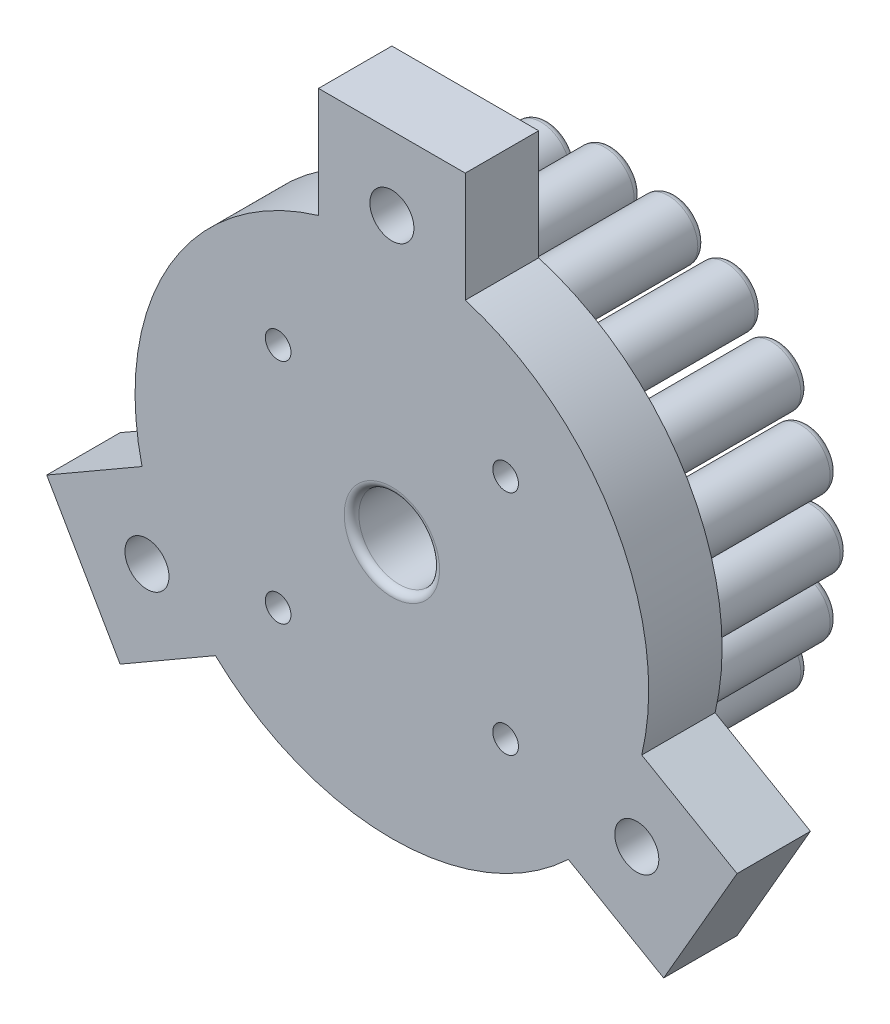
from build123d import *

# Parameters (mm, degrees)
SKIZZE1_R                          = 4
AUFSATZ_LINEAR_AUSTRAGEN1_DEPTH    = 20
AUFSATZ_LINEAR_AUSTRAGEN1_2_DEPTH  = 20
AUFSATZ_LINEAR_AUSTRAGEN1_3_DEPTH  = 20
AUFSATZ_LINEAR_AUSTRAGEN1_4_DEPTH  = 20
AUFSATZ_LINEAR_AUSTRAGEN1_5_DEPTH  = 20
AUFSATZ_LINEAR_AUSTRAGEN1_6_DEPTH  = 20
AUFSATZ_LINEAR_AUSTRAGEN1_7_DEPTH  = 20
AUFSATZ_LINEAR_AUSTRAGEN1_8_DEPTH  = 20
AUFSATZ_LINEAR_AUSTRAGEN1_9_DEPTH  = 20
AUFSATZ_LINEAR_AUSTRAGEN1_10_DEPTH = 20
AUFSATZ_LINEAR_AUSTRAGEN1_11_DEPTH = 20
AUFSATZ_LINEAR_AUSTRAGEN1_12_DEPTH = 20
AUFSATZ_LINEAR_AUSTRAGEN1_13_DEPTH = 20
AUFSATZ_LINEAR_AUSTRAGEN1_14_DEPTH = 20
AUFSATZ_LINEAR_AUSTRAGEN1_15_DEPTH = 20
AUFSATZ_LINEAR_AUSTRAGEN1_16_DEPTH = 20
AUFSATZ_LINEAR_AUSTRAGEN1_17_DEPTH = 20
AUFSATZ_LINEAR_AUSTRAGEN1_18_DEPTH = 20
AUFSATZ_LINEAR_AUSTRAGEN1_19_DEPTH = 20
AUFSATZ_LINEAR_AUSTRAGEN1_20_DEPTH = 20
SKIZZE5_R                          = 35
AUFSATZ_LINEAR_AUSTRAGEN2_DEPTH    = 10
SKIZZE6_R                          = 5.5
SCHNITT_LINEAR_AUSTRAGEN1_DEPTH    = 10
SKIZZE7_W                          = 20
SKIZZE7_H                          = 15
AUFSATZ_LINEAR_AUSTRAGEN3_DEPTH    = 10
SCHNITT_LINEAR_AUSTRAGEN3_REACH    = 75.951
SKIZZE9_R                          = 3
VERRUNDUNG1_R                      = 1
VERRUNDUNG2_R                      = 1
SKIZZE10_R                         = 1.75
SCHNITT_LINEAR_AUSTRAGEN4_DEPTH    = 10
SKIZZE12_R                         = 3.3
SCHNITT_LINEAR_AUSTRAGEN5_DEPTH    = 3


with BuildPart() as part:
    # Skizze1 → Aufsatz-Linear austragen1 (new body)
    with BuildSketch(Plane.XY):
        with Locations((0, 28.1)):
            Circle(SKIZZE1_R)
    extrude(amount=AUFSATZ_LINEAR_AUSTRAGEN1_DEPTH)



with BuildPart() as body_2:
    # Skizze1 → Aufsatz-Linear austragen1 2 (new body)
    with BuildSketch(Plane.XY):
        with Locations((8.683377542, 26.724688108)):
            Circle(SKIZZE1_R)
    extrude(amount=AUFSATZ_LINEAR_AUSTRAGEN1_2_DEPTH)


with BuildPart() as body_3:
    # Skizze1 → Aufsatz-Linear austragen1 3 (new body)
    with BuildSketch(Plane.XY):
        with Locations((16.516765589, 22.733377542)):
            Circle(SKIZZE1_R)
    extrude(amount=AUFSATZ_LINEAR_AUSTRAGEN1_3_DEPTH)


with BuildPart() as body_4:
    # Skizze1 → Aufsatz-Linear austragen1 4 (new body)
    with BuildSketch(Plane.XY):
        with Locations((22.733377542, 16.516765589)):
            Circle(SKIZZE1_R)
    extrude(amount=AUFSATZ_LINEAR_AUSTRAGEN1_4_DEPTH)


with BuildPart() as body_5:
    # Skizze1 → Aufsatz-Linear austragen1 5 (new body)
    with BuildSketch(Plane.XY):
        with Locations((26.724688108, 8.683377542)):
            Circle(SKIZZE1_R)
    extrude(amount=AUFSATZ_LINEAR_AUSTRAGEN1_5_DEPTH)


with BuildPart() as body_6:
    # Skizze1 → Aufsatz-Linear austragen1 6 (new body)
    with BuildSketch(Plane.XY):
        with Locations((28.1, 0)):
            Circle(SKIZZE1_R)
    extrude(amount=AUFSATZ_LINEAR_AUSTRAGEN1_6_DEPTH)


with BuildPart() as body_7:
    # Skizze1 → Aufsatz-Linear austragen1 7 (new body)
    with BuildSketch(Plane.XY):
        with Locations((26.724688108, -8.683377542)):
            Circle(SKIZZE1_R)
    extrude(amount=AUFSATZ_LINEAR_AUSTRAGEN1_7_DEPTH)


with BuildPart() as body_8:
    # Skizze1 → Aufsatz-Linear austragen1 8 (new body)
    with BuildSketch(Plane.XY):
        with Locations((22.733377542, -16.516765589)):
            Circle(SKIZZE1_R)
    extrude(amount=AUFSATZ_LINEAR_AUSTRAGEN1_8_DEPTH)


with BuildPart() as body_9:
    # Skizze1 → Aufsatz-Linear austragen1 9 (new body)
    with BuildSketch(Plane.XY):
        with Locations((16.516765589, -22.733377542)):
            Circle(SKIZZE1_R)
    extrude(amount=AUFSATZ_LINEAR_AUSTRAGEN1_9_DEPTH)


with BuildPart() as body_10:
    # Skizze1 → Aufsatz-Linear austragen1 10 (new body)
    with BuildSketch(Plane.XY):
        with Locations((8.683377542, -26.724688108)):
            Circle(SKIZZE1_R)
    extrude(amount=AUFSATZ_LINEAR_AUSTRAGEN1_10_DEPTH)


with BuildPart() as body_11:
    # Skizze1 → Aufsatz-Linear austragen1 11 (new body)
    with BuildSketch(Plane.XY):
        with Locations((0, -28.1)):
            Circle(SKIZZE1_R)
    extrude(amount=AUFSATZ_LINEAR_AUSTRAGEN1_11_DEPTH)


with BuildPart() as body_12:
    # Skizze1 → Aufsatz-Linear austragen1 12 (new body)
    with BuildSketch(Plane.XY):
        with Locations((-8.683377542, -26.724688108)):
            Circle(SKIZZE1_R)
    extrude(amount=AUFSATZ_LINEAR_AUSTRAGEN1_12_DEPTH)


with BuildPart() as body_13:
    # Skizze1 → Aufsatz-Linear austragen1 13 (new body)
    with BuildSketch(Plane.XY):
        with Locations((-16.516765589, -22.733377542)):
            Circle(SKIZZE1_R)
    extrude(amount=AUFSATZ_LINEAR_AUSTRAGEN1_13_DEPTH)


with BuildPart() as body_14:
    # Skizze1 → Aufsatz-Linear austragen1 14 (new body)
    with BuildSketch(Plane.XY):
        with Locations((-22.733377542, -16.516765589)):
            Circle(SKIZZE1_R)
    extrude(amount=AUFSATZ_LINEAR_AUSTRAGEN1_14_DEPTH)


with BuildPart() as body_15:
    # Skizze1 → Aufsatz-Linear austragen1 15 (new body)
    with BuildSketch(Plane.XY):
        with Locations((-26.724688108, -8.683377542)):
            Circle(SKIZZE1_R)
    extrude(amount=AUFSATZ_LINEAR_AUSTRAGEN1_15_DEPTH)


with BuildPart() as body_16:
    # Skizze1 → Aufsatz-Linear austragen1 16 (new body)
    with BuildSketch(Plane.XY):
        with Locations((-28.1, 0)):
            Circle(SKIZZE1_R)
    extrude(amount=AUFSATZ_LINEAR_AUSTRAGEN1_16_DEPTH)


with BuildPart() as body_17:
    # Skizze1 → Aufsatz-Linear austragen1 17 (new body)
    with BuildSketch(Plane.XY):
        with Locations((-26.724688108, 8.683377542)):
            Circle(SKIZZE1_R)
    extrude(amount=AUFSATZ_LINEAR_AUSTRAGEN1_17_DEPTH)


with BuildPart() as body_18:
    # Skizze1 → Aufsatz-Linear austragen1 18 (new body)
    with BuildSketch(Plane.XY):
        with Locations((-22.733377542, 16.516765589)):
            Circle(SKIZZE1_R)
    extrude(amount=AUFSATZ_LINEAR_AUSTRAGEN1_18_DEPTH)


with BuildPart() as body_19:
    # Skizze1 → Aufsatz-Linear austragen1 19 (new body)
    with BuildSketch(Plane.XY):
        with Locations((-16.516765589, 22.733377542)):
            Circle(SKIZZE1_R)
    extrude(amount=AUFSATZ_LINEAR_AUSTRAGEN1_19_DEPTH)


with BuildPart() as body_20:
    # Skizze1 → Aufsatz-Linear austragen1 20 (new body)
    with BuildSketch(Plane.XY):
        with Locations((-8.683377542, 26.724688108)):
            Circle(SKIZZE1_R)
    extrude(amount=AUFSATZ_LINEAR_AUSTRAGEN1_20_DEPTH)


with BuildPart() as part_1:
    add(part.part)

    add(body_2.part)  # Aufsatz-Linear austragen2 merges body 2

    add(body_3.part)  # Aufsatz-Linear austragen2 merges body 3

    add(body_4.part)  # Aufsatz-Linear austragen2 merges body 4

    add(body_5.part)  # Aufsatz-Linear austragen2 merges body 5

    add(body_6.part)  # Aufsatz-Linear austragen2 merges body 6

    add(body_7.part)  # Aufsatz-Linear austragen2 merges body 7

    add(body_8.part)  # Aufsatz-Linear austragen2 merges body 8

    add(body_9.part)  # Aufsatz-Linear austragen2 merges body 9

    add(body_10.part)  # Aufsatz-Linear austragen2 merges body 10

    add(body_11.part)  # Aufsatz-Linear austragen2 merges body 11

    add(body_12.part)  # Aufsatz-Linear austragen2 merges body 12

    add(body_13.part)  # Aufsatz-Linear austragen2 merges body 13

    add(body_14.part)  # Aufsatz-Linear austragen2 merges body 14

    add(body_15.part)  # Aufsatz-Linear austragen2 merges body 15

    add(body_16.part)  # Aufsatz-Linear austragen2 merges body 16

    add(body_17.part)  # Aufsatz-Linear austragen2 merges body 17

    add(body_18.part)  # Aufsatz-Linear austragen2 merges body 18

    add(body_19.part)  # Aufsatz-Linear austragen2 merges body 19

    add(body_20.part)  # Aufsatz-Linear austragen2 merges body 20
    # Skizze5 → Aufsatz-Linear austragen2 (add)
    with BuildSketch(Plane.XY.offset(20)):
        Circle(SKIZZE5_R)
    extrude(amount=AUFSATZ_LINEAR_AUSTRAGEN2_DEPTH)

    # Skizze6 → Schnitt-Linear austragen1 (cut)
    with BuildSketch(Plane.XY.offset(30)):
        Circle(SKIZZE6_R)
    extrude(amount=-SCHNITT_LINEAR_AUSTRAGEN1_DEPTH, mode=Mode.SUBTRACT)

    # Skizze7 → Aufsatz-Linear austragen3 (add)
    with BuildSketch(Plane.XY.offset(30)):
        with Locations((0, 41.041019662)):
            Rectangle(SKIZZE7_W, SKIZZE7_H)
        Polygon((34.047375097, -8.110255793), (47.037756153, -15.610255793), (37.037756153, -32.930763869), (24.047375097, -25.430763869), align=None)
        Polygon((-24.047375097, -25.430763869), (-37.037756153, -32.930763869), (-47.037756153, -15.610255793), (-34.047375097, -8.110255793), align=None)
    extrude(amount=-AUFSATZ_LINEAR_AUSTRAGEN3_DEPTH)

    # Skizze9 → Schnitt-Linear austragen3 (cut, up to next)
    with BuildSketch(Plane.XY.offset(30), mode=Mode.PRIVATE) as schnitt_linear_austragen3_sk1:
        with Locations((0, 38.541019662)):
            Circle(SKIZZE9_R)
    schnitt_linear_austragen3_tool1 = extrude(schnitt_linear_austragen3_sk1.sketch, amount=-SCHNITT_LINEAR_AUSTRAGEN3_REACH, mode=Mode.PRIVATE) & part_1.part
    # Skizze9 → Schnitt-Linear austragen3 (cut, up to next)
    with BuildSketch(Plane.XY.offset(30), mode=Mode.PRIVATE) as schnitt_linear_austragen3_sk2:
        with Locations((33.377502115, -19.270509831)):
            Circle(SKIZZE9_R)
    schnitt_linear_austragen3_tool2 = extrude(schnitt_linear_austragen3_sk2.sketch, amount=-SCHNITT_LINEAR_AUSTRAGEN3_REACH, mode=Mode.PRIVATE) & part_1.part
    # Skizze9 → Schnitt-Linear austragen3 (cut, up to next)
    with BuildSketch(Plane.XY.offset(30), mode=Mode.PRIVATE) as schnitt_linear_austragen3_sk3:
        with Locations((-33.377502115, -19.270509831)):
            Circle(SKIZZE9_R)
    schnitt_linear_austragen3_tool3 = extrude(schnitt_linear_austragen3_sk3.sketch, amount=-SCHNITT_LINEAR_AUSTRAGEN3_REACH, mode=Mode.PRIVATE) & part_1.part
    add(schnitt_linear_austragen3_tool1.solids().sort_by_distance((0, 38.54102, 30))[0], mode=Mode.SUBTRACT)
    add(schnitt_linear_austragen3_tool2.solids().sort_by_distance((33.377502, -19.27051, 30))[0], mode=Mode.SUBTRACT)
    add(schnitt_linear_austragen3_tool3.solids().sort_by_distance((-33.377502, -19.27051, 30))[0], mode=Mode.SUBTRACT)

    # Verrundung1
    verrundung1_edges = [part_1.edges().sort_by_distance(p)[0] for p in [
        (-5.5, 0, 20),
        (-5.5, 0, 30),
    ]]
    fillet(verrundung1_edges, radius=VERRUNDUNG1_R)

    # Verrundung2
    verrundung2_edges = [part_1.edges().sort_by_distance(p)[0] for p in [
        (22.724688108, 8.683377542, 0),
        (-20.516765589, -22.733377542, 0),
        (-12.683377542, -26.724688108, 0),
        (-4, -28.1, 0),
        (4.683377542, -26.724688108, 0),
        (12.516765589, -22.733377542, 0),
        (18.733377542, -16.516765589, 0),
        (22.724688108, -8.683377542, 0),
        (24.1, 0, 0),
        (18.733377542, 16.516765589, 0),
        (12.516765589, 22.733377542, 0),
        (4.683377542, 26.724688108, 0),
        (-26.733377542, -16.516765589, 0),
        (-30.724688108, -8.683377542, 0),
        (-32.1, 0, 0),
        (-30.724688108, 8.683377542, 0),
        (-26.733377542, 16.516765589, 0),
        (-20.516765589, 22.733377542, 0),
        (-12.683377542, 26.724688108, 0),
        (-4, 28.1, 0),
    ]]
    fillet(verrundung2_edges, radius=VERRUNDUNG2_R)

    # Skizze10 → Schnitt-Linear austragen4 (cut)
    with BuildSketch(Plane.XY.offset(30)):
        with Locations((-15.5, 15.5)):
            Circle(SKIZZE10_R)
        with Locations((15.5, 15.5)):
            Circle(SKIZZE10_R)
        with Locations((15.5, -15.5)):
            Circle(SKIZZE10_R)
        with Locations((-15.5, -15.5)):
            Circle(SKIZZE10_R)
    extrude(amount=-SCHNITT_LINEAR_AUSTRAGEN4_DEPTH, mode=Mode.SUBTRACT)

    # Skizze12 → Schnitt-Linear austragen5 (cut)
    with BuildSketch(Plane(origin=(0, 0, 20), x_dir=(-1, 0, 0), z_dir=(0, 0, -1))):
        with Locations((-15.5, 15.5)):
            Circle(SKIZZE12_R)
        with Locations((15.5, 15.5)):
            Circle(SKIZZE12_R)
        with Locations((-15.5, -15.5)):
            Circle(SKIZZE12_R)
        with Locations((15.5, -15.5)):
            Circle(SKIZZE12_R)
    extrude(amount=-SCHNITT_LINEAR_AUSTRAGEN5_DEPTH, mode=Mode.SUBTRACT)


solid = part_1.part
